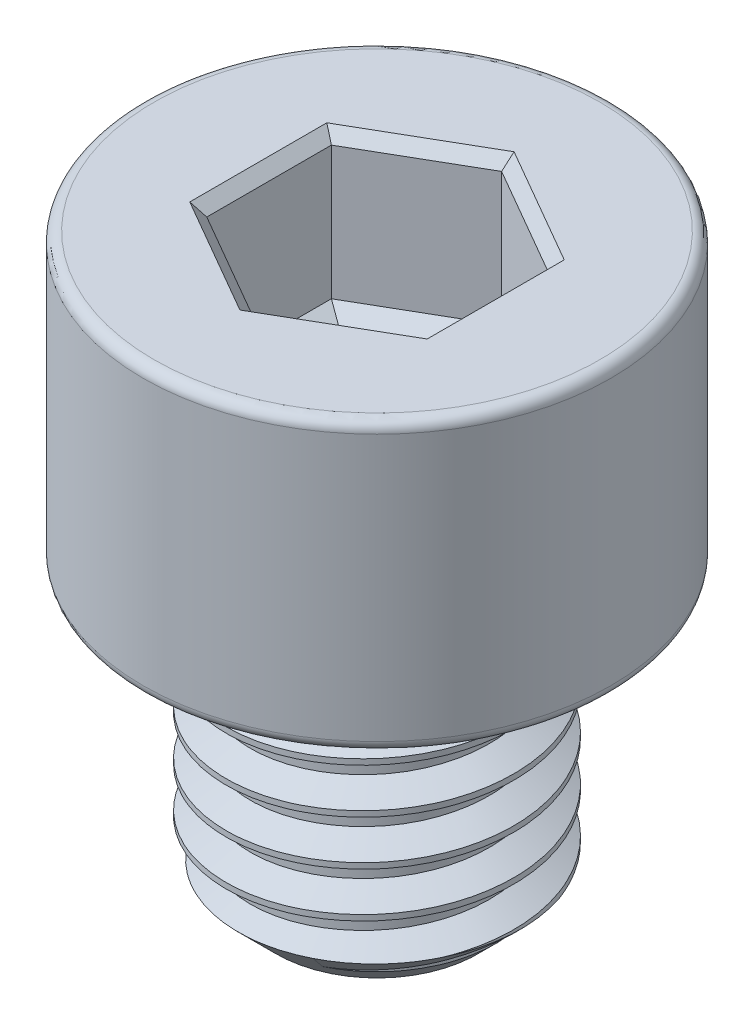
from build123d import *

# Parameters (mm, degrees)
SKETCH1_R           = 4
BOSS_EXTRUDE1_DEPTH = 8
THREAD1_PITCH       = 1.25
SKETCH2_R           = 6.5
BOSS_EXTRUDE2_DEPTH = 8
FILLET1_R           = 0.3
CUT_EXTRUDE1_DEPTH  = 4
CHAMFER1_SIZE       = 0.3
CUT_EXTRUDE2_DEPTH  = 0.4
CUT_EXTRUDE2_DRAFT  = -60


with BuildPart() as part:
    # Sketch1 → Boss-Extrude1 (new body)
    with BuildSketch(Plane(origin=(0, 0, 0), x_dir=(1, 0, 0), z_dir=(0, 1, 0))):
        with Locations(Location((0, 0, 0), (0, 0, 270))):
            Circle(SKETCH1_R)
    extrude(amount=BOSS_EXTRUDE1_DEPTH)

    # Thread1: the profile of Thread Profile1 profile screwed along a right-hand helix of 7.4 turns, 8 arcs to a turn; built about Z, then put on its axis
    thread1_z = Axis((0, 0, 0), (0, 0, 1))
    thread1_corners = [(4.0003, 0, -0.000173205), (4.0003, 0, 1.093923202), (3.323417656, 0, 0.703124998), (3.323417656, 0, 0.390624998)]
    with BuildLine(mode=Mode.PRIVATE) as thread1_profile:
        Line(thread1_corners[0], thread1_corners[1])
        Line(thread1_corners[1], thread1_corners[2])
        Line(thread1_corners[2], thread1_corners[3])
        Line(thread1_corners[3], thread1_corners[0])
    thread1_cap = Face(thread1_profile.wire())
    thread1_turn_angles = [0, 22.5, 45, 67.5, 90, 112.5, 135, 157.5, 180, 202.5, 225, 247.5, 270, 292.5, 315, 337.5, 360]
    thread1_turn_weights = [1, 0.9238795325112867, 1, 0.9238795325112867, 1, 0.9238795325112867, 1, 0.9238795325112867, 1, 0.9238795325112867, 1, 0.9238795325112867, 1, 0.9238795325112867, 1, 0.9238795325112867, 1]
    thread1_turn_rails = [Edge.make_bspline([Vector(p[0], p[1], 0).rotate(thread1_z, thread1_turn_angles[k]) / thread1_turn_weights[k] + Vector(0, 0, p[2] + THREAD1_PITCH * thread1_turn_angles[k] / 360) for k in range(17)], [0, 0, 0, 1, 1, 2, 2, 3, 3, 4, 4, 5, 5, 6, 6, 7, 7, 8, 8, 8], 2, thread1_turn_weights) for p in thread1_corners]
    thread1_turn_sides = [Face.make_surface_from_curves(thread1_turn_rails[p[0]], thread1_turn_rails[p[1]]) for p in [(0, 1), (1, 2), (2, 3), (3, 0)]]
    thread1_last_angles = [2520, 2542.5, 2565, 2587.5, 2610, 2632.5, 2655, 2659.5, 2664]
    thread1_last_weights = [1, 0.9238795325112867, 1, 0.9238795325112867, 1, 0.9238795325112867, 1, 0.996917333733128, 1]
    thread1_last_rails = [Edge.make_bspline([Vector(p[0], p[1], 0).rotate(thread1_z, thread1_last_angles[k]) / thread1_last_weights[k] + Vector(0, 0, p[2] + THREAD1_PITCH * thread1_last_angles[k] / 360) for k in range(9)], [0, 0, 0, 1, 1, 2, 2, 3, 3, 4, 4, 4], 2, thread1_last_weights) for p in thread1_corners]
    thread1_last_sides = [Face.make_surface_from_curves(thread1_last_rails[p[0]], thread1_last_rails[p[1]]) for p in [(0, 1), (1, 2), (2, 3), (3, 0)]]
    thread1 = Plane(origin=(0, 9.25, 0), x_dir=(-1, 0, 0), z_dir=(0, -1, 0)) * Solid(Shell([*[p.moved(Location((0, 0, THREAD1_PITCH * i))) for i in range(7) for p in thread1_turn_sides], *thread1_last_sides, thread1_cap, thread1_cap.rotate(thread1_z, 2664).moved(Location((0, 0, THREAD1_PITCH * 2664 / 360)))]))
    add(thread1, mode=Mode.SUBTRACT)

    # Sketch2 → Boss-Extrude2 (add)
    with BuildSketch(Plane(origin=(0, 8, 0), x_dir=(1, 0, 0), z_dir=(0, 1, 0))):
        with Locations(Location((0, 0, 0), (0, 0, 270))):
            Circle(SKETCH2_R)
    extrude(amount=BOSS_EXTRUDE2_DEPTH)

    # Sketch5 → Cut-Revolve1 (revolve, cut)
    with BuildSketch(Plane.XY, mode=Mode.PRIVATE) as cut_revolve1_sk:
        Polygon((4.01, 0), (4.01, 1.2), (2.81, 0), align=None)
    revolve(cut_revolve1_sk.sketch.rotate(Axis((0, 0, 0), (0, 1, 0)), 296.268443729), axis=Axis((0, 0, 0), (0, 1, 0)), mode=Mode.SUBTRACT)

    # Fillet1
    fillet1_edges = [part.edges().sort_by_distance(p)[0] for p in [
        (0, 8, -6.5),
        (0, 16, -6.5),
    ]]
    fillet(fillet1_edges, radius=FILLET1_R)

    # Sketch6 → Cut-Extrude1 (cut)
    with BuildSketch(Plane(origin=(0, 16, 0), x_dir=(1, 0, 0), z_dir=(0, 1, 0))):
        Polygon((0, 3.464101615), (-3, 1.732050808), (-3, -1.732050808), (0, -3.464101615), (3, -1.732050808), (3, 1.732050808), align=None)
    extrude(amount=-CUT_EXTRUDE1_DEPTH, mode=Mode.SUBTRACT)

    # Chamfer1
    chamfer1_edges = [part.edges().sort_by_distance(p)[0] for p in [
        (1.5, 16, -2.598076211),
        (-1.5, 16, -2.598076211),
        (-3, 16, 0),
        (-1.5, 16, 2.598076211),
        (1.5, 16, 2.598076211),
        (3, 16, 0),
    ]]
    chamfer(chamfer1_edges, length=CHAMFER1_SIZE)


with BuildPart() as cut_extrude2_tool:
    # Sketch7 → Cut-Extrude2 (with draft: the straight prism first)
    with BuildSketch(Plane(origin=(0, 12, 0), x_dir=(1, 0, 0), z_dir=(0, 1, 0))):
        Polygon((0, 3.464101615), (-3, 1.732050808), (-3, -1.732050808), (0, -3.464101615), (3, -1.732050808), (3, 1.732050808), align=None)
    extrude(amount=-CUT_EXTRUDE2_DEPTH)
    # Cut-Extrude2: the draft: its side faces are tilted about the plane it starts from
    cut_extrude2_sides = [cut_extrude2_tool.faces().sort_by_distance(p)[0] for p in [
        (-1.5, 11.8, -2.598076211),
        (-3, 11.8, 0),
        (-1.5, 11.8, 2.598076211),
        (1.5, 11.8, 2.598076211),
        (3, 11.8, 0),
        (1.5, 11.8, -2.598076211),
    ]]
    draft(cut_extrude2_sides, Plane(origin=(0, 12, 0), x_dir=(1, 0, 0), z_dir=(0, 1, 0)), CUT_EXTRUDE2_DRAFT)


with BuildPart() as part_1:
    add(part.part)

    # Cut-Extrude2: cut by cut_extrude2_tool
    add(cut_extrude2_tool.part, mode=Mode.SUBTRACT)


solid = part_1.part
